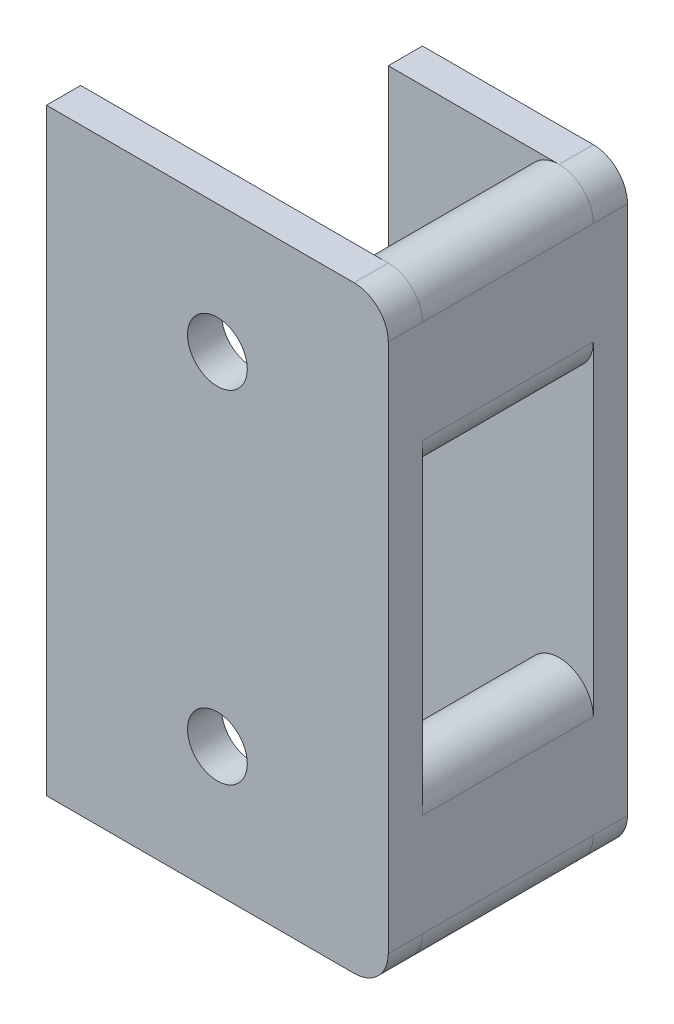
from build123d import *

# Parameters (mm, degrees)
ESQUISSE1_W        = 20
ESQUISSE1_H        = 35
ESQUISSE1_R        = 1.75
BOSS_EXTRU_1_DEPTH = 2
BOSS_EXTRU_2_DEPTH = 10
ESQUISSE3_W        = 12
ESQUISSE3_H        = 35
BOSS_EXTRU_3_DEPTH = 2
CONG_1_R           = 2


with BuildPart() as part:
    # Esquisse1 → Boss.-Extru.1 (new body)
    with BuildSketch(Plane.XY):
        with Locations((-6.602456785, 20.295838232)):
            Rectangle(ESQUISSE1_W, ESQUISSE1_H)
        with Locations((-6.602456785, 30.295838232)):
            Circle(ESQUISSE1_R, mode=Mode.SUBTRACT)
        with Locations((-6.602456785, 10.295838232)):
            Circle(ESQUISSE1_R, mode=Mode.SUBTRACT)
    extrude(amount=-BOSS_EXTRU_1_DEPTH)

    # Esquisse2 → Boss.-Extru.2 (add)
    with BuildSketch(Plane(origin=(0, 0, -2), x_dir=(-1, 0, 0), z_dir=(0, 0, -1))):
        with BuildLine():
            Line((0.602456785, 35.795838232), (0.602456785, 29.795838232))
            ThreePointArc((0.602456785, 29.795838232), (-1.397543215, 27.795838232), (-3.397543215, 29.795838232))
            Line((-3.397543215, 29.795838232), (-3.397543215, 35.795838232))
            ThreePointArc((-3.397543215, 35.795838232), (-1.397543215, 37.795838232), (0.602456785, 35.795838232))
        make_face()
        with BuildLine():
            Line((0.602456785, 4.795838232), (0.602456785, 10.795838232))
            ThreePointArc((0.602456785, 10.795838232), (-1.397543215, 12.795838232), (-3.397543215, 10.795838232))
            Line((-3.397543215, 10.795838232), (-3.397543215, 4.795838232))
            ThreePointArc((-3.397543215, 4.795838232), (-1.397543215, 2.795838232), (0.602456785, 4.795838232))
        make_face()
    extrude(amount=BOSS_EXTRU_2_DEPTH)

    # Esquisse3 → Boss.-Extru.3 (add)
    with BuildSketch(Plane(origin=(0, 0, -12), x_dir=(-1, 0, 0), z_dir=(0, 0, -1))):
        with Locations((2.602456785, 20.295838232)):
            Rectangle(ESQUISSE3_W, ESQUISSE3_H)
    extrude(amount=BOSS_EXTRU_3_DEPTH)

    # Congé1
    cong_1_edges = [part.edges().sort_by_distance(p)[0] for p in [
        (3.397543215, 2.795838232, -1),
        (3.397543215, 37.795838232, -13),
        (3.397543215, 2.795838232, -13),
        (3.397543215, 37.795838232, -1),
    ]]
    fillet(cong_1_edges, radius=CONG_1_R - 0.0001)  # a hair under: the kernel refuses the full size


solid = part.part
